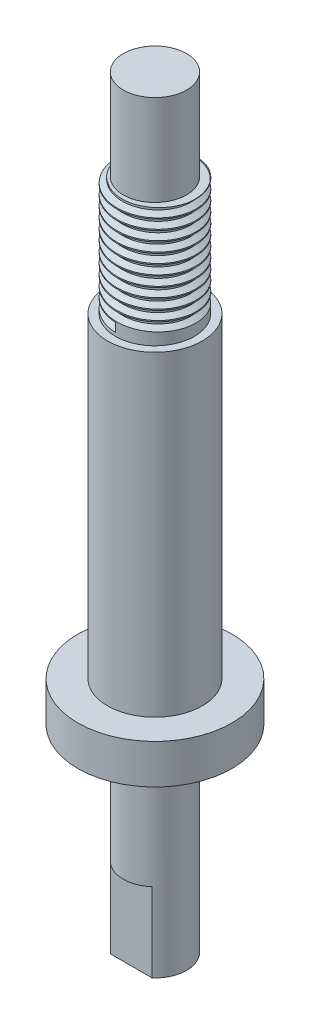
from build123d import *

# Parameters (mm, degrees)
SKETCH1_R           = 9.75
BOSS_EXTRUDE1_DEPTH = 5
SKETCH2_R           = 6
BOSS_EXTRUDE2_DEPTH = 40
SKETCH3_R           = 4
BOSS_EXTRUDE3_DEPTH = 26.5
BOSS_EXTRUDE4_START = 25
SKETCH4_R           = 4
BOSS_EXTRUDE4_DEPTH = 25
CUT_EXTRUDE1_DEPTH  = 10
SKETCH10_R          = 5
SKETCH10_R_2        = 4
BOSS_EXTRUDE5_DEPTH = 15
CUT_SWEEP1_PITCH    = 1.25


with BuildPart() as part:
    # Sketch1 → Boss-Extrude1 (new body)
    with BuildSketch(Plane(origin=(0, 0, 0), x_dir=(1, 0, 0), z_dir=(0, 1, 0))):
        with Locations(Location((0, 0, 0), (0, 0, 270))):
            Circle(SKETCH1_R)
    extrude(amount=BOSS_EXTRUDE1_DEPTH)

    # Sketch2 → Boss-Extrude2 (add)
    with BuildSketch(Plane(origin=(0, 5, 0), x_dir=(1, 0, 0), z_dir=(0, 1, 0))):
        with Locations(Location((0, 0, 0), (0, 0, 270))):
            Circle(SKETCH2_R)
    extrude(amount=BOSS_EXTRUDE2_DEPTH)

    # Sketch3 → Boss-Extrude3 (add)
    with BuildSketch(Plane(origin=(0, 45, 0), x_dir=(1, 0, 0), z_dir=(0, 1, 0))):
        with Locations(Location((0, 0, 0), (0, 0, 270))):
            Circle(SKETCH3_R)
    extrude(amount=BOSS_EXTRUDE3_DEPTH)

    # Sketch4 → Boss-Extrude4 (add)
    with BuildSketch(Plane.XZ.offset(BOSS_EXTRUDE4_START)):
        with Locations(Location((0, 0, 0), (0, 0, 90))):
            Circle(SKETCH4_R)
    extrude(amount=-BOSS_EXTRUDE4_DEPTH)

    # Sketch5 → Cut-Extrude1 (cut)
    with BuildSketch(Plane.XZ.offset(25)):
        with BuildLine():
            Line((-2.645751311, 3), (2.645751311, 3))
            ThreePointArc((2.645751311, 3), (0, 4), (-2.645751311, 3))
        make_face()
    extrude(amount=-CUT_EXTRUDE1_DEPTH, mode=Mode.SUBTRACT)

    # Sketch10 → Boss-Extrude5 (add)
    with BuildSketch(Plane(origin=(0, 45, 0), x_dir=(1, 0, 0), z_dir=(0, 1, 0))):
        with Locations(Location((0, 0, 0), (0, 0, 270))):
            Circle(SKETCH10_R)
        with Locations(Location((0, 0, 0), (0, 0, 270))):
            Circle(SKETCH10_R_2, mode=Mode.SUBTRACT)
    extrude(amount=BOSS_EXTRUDE5_DEPTH)

    # Cut-Sweep1: arcs per turn and ends read off the stored shape
    # Cut-Sweep1: the profile of Sketch14 screwed along a left-hand helix through 12.25 turns, 8 arcs to a turn; built about Z, then put on its axis
    cut_sweep1_z = Axis((0, 0, 0), (0, 0, 1))
    cut_sweep1_corners = [(5.012615432, 0.021545687, 0.541502187), (5.012615432, -0.022852989, -0.57435825), (4.322615432, -0.007014815, -0.17630153), (4.322615432, 0.005707514, 0.143445467)]
    with BuildLine(mode=Mode.PRIVATE) as cut_sweep1_profile:
        Line(cut_sweep1_corners[0], cut_sweep1_corners[1])
        Line(cut_sweep1_corners[1], cut_sweep1_corners[2])
        Line(cut_sweep1_corners[2], cut_sweep1_corners[3])
        Line(cut_sweep1_corners[3], cut_sweep1_corners[0])
    cut_sweep1_cap = Face(cut_sweep1_profile.wire())
    cut_sweep1_turn_angles = [0, -22.5, -45, -67.5, -90, -112.5, -135, -157.5, -180, -202.5, -225, -247.5, -270, -292.5, -315, -337.5, -360]
    cut_sweep1_turn_weights = [1, 0.9238795325112867, 1, 0.9238795325112867, 1, 0.9238795325112867, 1, 0.9238795325112867, 1, 0.9238795325112867, 1, 0.9238795325112867, 1, 0.9238795325112867, 1, 0.9238795325112867, 1]
    cut_sweep1_turn_rails = [Edge.make_bspline([Vector(p[0], p[1], 0).rotate(cut_sweep1_z, cut_sweep1_turn_angles[k]) / cut_sweep1_turn_weights[k] + Vector(0, 0, p[2] + -CUT_SWEEP1_PITCH * cut_sweep1_turn_angles[k] / 360) for k in range(17)], [0, 0, 0, 1, 1, 2, 2, 3, 3, 4, 4, 5, 5, 6, 6, 7, 7, 8, 8, 8], 2, cut_sweep1_turn_weights) for p in cut_sweep1_corners]
    cut_sweep1_turn_sides = [Face.make_surface_from_curves(cut_sweep1_turn_rails[p[0]], cut_sweep1_turn_rails[p[1]]) for p in [(0, 1), (1, 2), (2, 3), (3, 0)]]
    cut_sweep1_last_angles = [-4320, -4342.5, -4365, -4387.5, -4410]
    cut_sweep1_last_weights = [1, 0.9238795325112867, 1, 0.923879532511226, 1]
    cut_sweep1_last_rails = [Edge.make_bspline([Vector(p[0], p[1], 0).rotate(cut_sweep1_z, cut_sweep1_last_angles[k]) / cut_sweep1_last_weights[k] + Vector(0, 0, p[2] + -CUT_SWEEP1_PITCH * cut_sweep1_last_angles[k] / 360) for k in range(5)], [0, 0, 0, 1, 1, 2, 2, 2], 2, cut_sweep1_last_weights) for p in cut_sweep1_corners]
    cut_sweep1_last_sides = [Face.make_surface_from_curves(cut_sweep1_last_rails[p[0]], cut_sweep1_last_rails[p[1]]) for p in [(0, 1), (1, 2), (2, 3), (3, 0)]]
    cut_sweep1 = Plane(origin=(0, 46, 0), x_dir=(0, 0, 1), z_dir=(0, 1, 0)) * Solid(Shell([*[p.moved(Location((0, 0, CUT_SWEEP1_PITCH * i))) for i in range(12) for p in cut_sweep1_turn_sides], *cut_sweep1_last_sides, cut_sweep1_cap, cut_sweep1_cap.rotate(cut_sweep1_z, -4410).moved(Location((0, 0, -CUT_SWEEP1_PITCH * -4410 / 360)))]))
    add(cut_sweep1, mode=Mode.SUBTRACT)


solid = part.part
